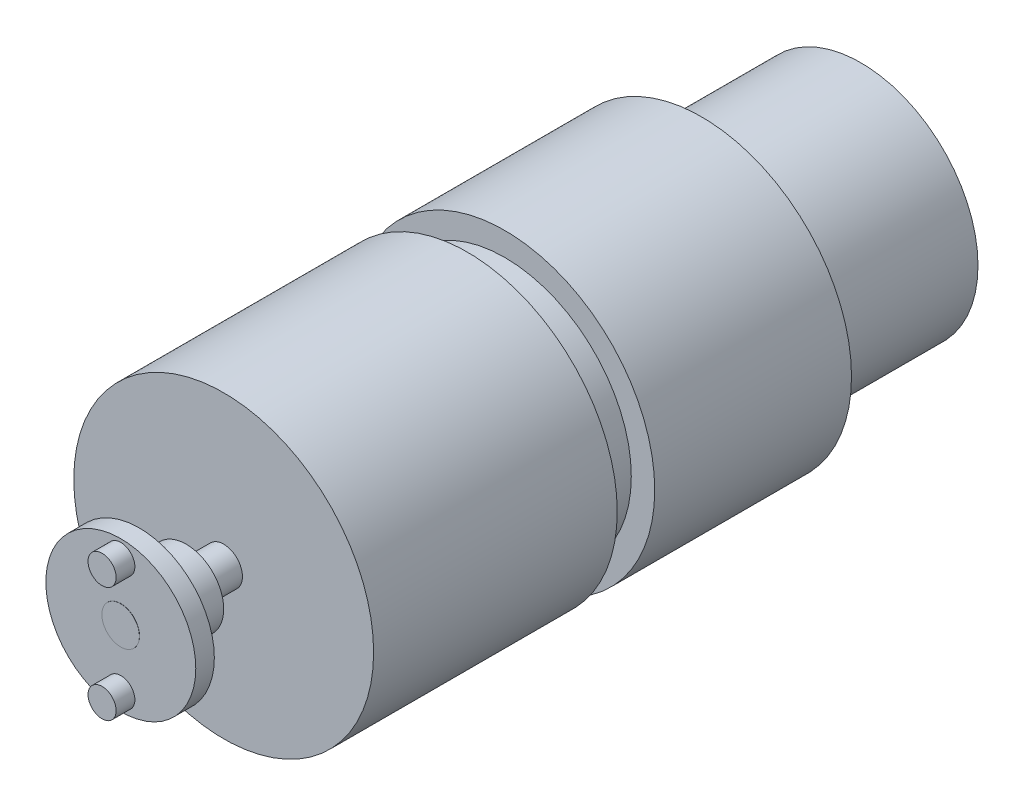
from build123d import *

# Parameters (mm, degrees)
SKETCH_1_R          = 12.5
EXTRUDE_1_DEPTH     = 17
SKETCH_2_R          = 16
EXTRUDE_2_DEPTH     = 51
SKETCH_3_R          = 2
EXTRUDE_3_DEPTH     = 11
SKETCH_4_R          = 4
EXTRUDE_4_DEPTH     = 5
SKETCH_5_R          = 8
EXTRUDE_5_DEPTH     = 1.98
SKETCH_6_R          = 1.5
EXTRUDE_6_DEPTH     = 2
SKETCH_7_R          = 20.782497367
SKETCH_7_R_2        = 13.5
CUT_EXTRUDE_8_DEPTH = 4


with BuildPart() as part:
    # Эскиз1 → Вытянуть1 (new body)
    with BuildSketch(Plane.XY):
        Circle(SKETCH_1_R)
    extrude(amount=EXTRUDE_1_DEPTH)

    # Эскиз2 → Вытянуть2 (add)
    with BuildSketch(Plane.XY.offset(17)):
        Circle(SKETCH_2_R)
    extrude(amount=EXTRUDE_2_DEPTH)

    # Эскиз3 → Вытянуть3 (add)
    with BuildSketch(Plane.XY.offset(68)):
        Circle(SKETCH_3_R)
    extrude(amount=EXTRUDE_3_DEPTH)

    # Эскиз4 → Вытянуть4 (add)
    with BuildSketch(Plane.XY.offset(72)):
        Circle(SKETCH_4_R)
    extrude(amount=EXTRUDE_4_DEPTH)

    # Эскиз5 → Вытянуть5 (add)
    with BuildSketch(Plane.XY.offset(77)):
        Circle(SKETCH_5_R)
    extrude(amount=EXTRUDE_5_DEPTH)

    # Эскиз6 → Вытянуть6 (add)
    with BuildSketch(Plane.XY.offset(78.98)):
        with Locations((0, -6.154904873)):
            Circle(SKETCH_6_R)
        with Locations((0, 6.154904873)):
            Circle(SKETCH_6_R)
    extrude(amount=EXTRUDE_6_DEPTH)

    # Эскиз7 → Вытянуть8 (cut)
    with BuildSketch(Plane.XY.offset(38)):
        Circle(SKETCH_7_R)
        Circle(SKETCH_7_R_2, mode=Mode.SUBTRACT)
    extrude(amount=CUT_EXTRUDE_8_DEPTH, mode=Mode.SUBTRACT)


solid = part.part
